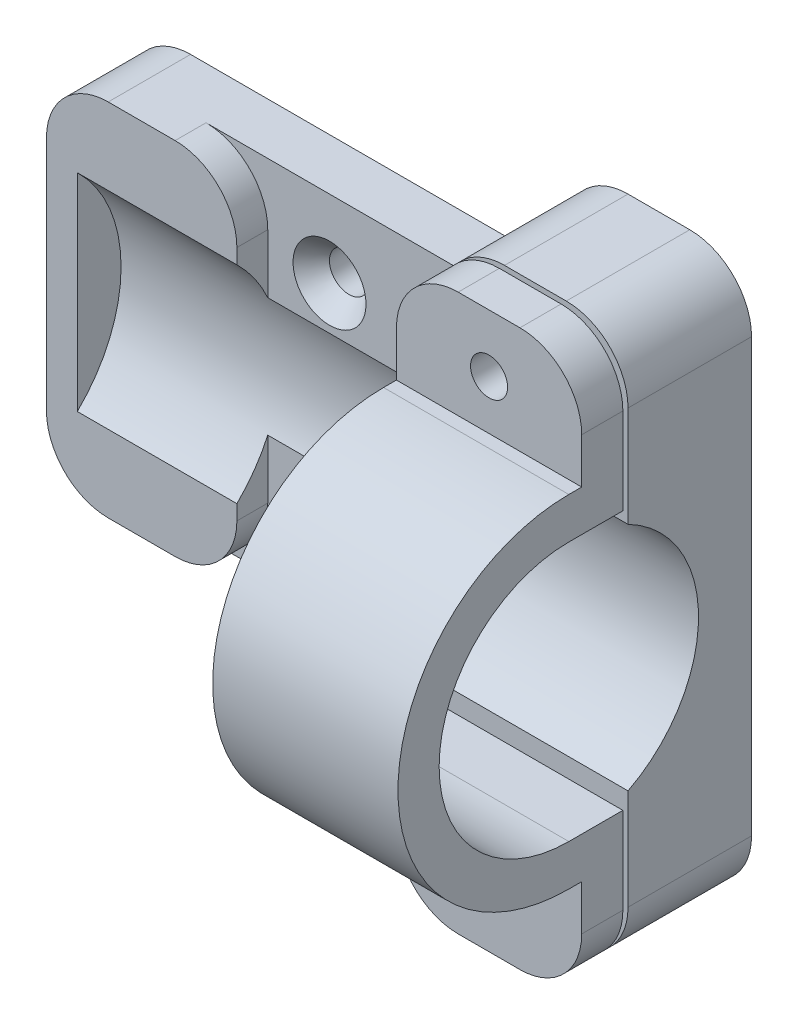
from build123d import *

# Parameters (mm, degrees)
BASE_SKETCH_W                        = 60.5
BASE_SKETCH_H                        = 35
BASE_EXTRUDE_DEPTH                   = 5
CRADLE_SKETCH_W                      = 18.5
CRADLE_SKETCH_H                      = 35
CRADLE_SKETCH_W_2                    = 18
CRADLE_SKETCH_H_2                    = 54
CRADLE_EXTRUDE_DEPTH                 = 12
NO_6_MOUNTING_HOLES_D                = 3.7973
NO_6_MOUNTING_HOLES_CSINK_D          = 7.0866
NO_6_MOUNTING_HOLES_CSINK_ANGLE      = 82
MOVE_START                           = 8
MOVE_FACE_OUTLINE_W                  = 18.5
MOVE_FACE_OUTLINE_H                  = 35
MOVE_FACE_DEPTH                      = 4
CLAMP_THREADED_HOLE_IN_BASE_D        = 2.5
CRADLE_FILLETS_R                     = 6
BASE_FILLETS_R                       = 6
MOTOR_START                          = 12
MOTOR_CLAMP_EXTRUDE_DEPTH            = 18
CLAMP_MOUNTING_HOLE_PROFILE_SKETCH_W = 1.8
CLAMP_MOUNTING_HOLE_PROFILE_SKETCH_H = 4
CLAMP_CORNER_FILLETS_R               = 6


# Read off the part's stored shape, not the designer's step: Move Face
with BuildPart() as part:
    # Base Sketch → Base Extrude (new body)
    with BuildSketch(Plane.XY):
        with Locations((-0.25, 0)):
            Rectangle(BASE_SKETCH_W, BASE_SKETCH_H)
    extrude(amount=BASE_EXTRUDE_DEPTH)

    # Cradle Sketch → Cradle Extrude (add)
    with BuildSketch(Plane.XY):
        with Locations((-21.25, 0)):
            Rectangle(CRADLE_SKETCH_W, CRADLE_SKETCH_H)
        with Locations((21, 0)):
            Rectangle(CRADLE_SKETCH_W_2, CRADLE_SKETCH_H_2)
    extrude(amount=CRADLE_EXTRUDE_DEPTH)

    # No. 6 Mounting Holes (through all)
    with Locations(Plane.XY.offset(5)):
        with Locations((-6, 10), (6, 10), (-6, -10), (6, -10)):
            CounterSinkHole(NO_6_MOUNTING_HOLES_D / 2, NO_6_MOUNTING_HOLES_CSINK_D / 2, counter_sink_angle=NO_6_MOUNTING_HOLES_CSINK_ANGLE)

    # Pump and Motor Revolve Cut Sketch → Pump and Motor Revolve Cut (revolve, cut)
    with BuildSketch(Plane(origin=(0, 0, 0), x_dir=(1, 0, 0), z_dir=(0, 1, 0))):
        Polygon((-27.5, -17.75), (-27.5, -3.75), (2, -3.75), (2, -5.15), (44.5, -5.15), (44.5, -17.75), align=None)
    revolve(axis=Axis((44.5, 0, 17.75), (-1, 0, 0)), mode=Mode.SUBTRACT)

    # Move Face outline → Move Face (cut)
    with BuildSketch(Plane.XY.offset(MOVE_START)):
        with Locations((-21.25, 0)):
            Rectangle(MOVE_FACE_OUTLINE_W, MOVE_FACE_OUTLINE_H)
    extrude(amount=MOVE_FACE_DEPTH, mode=Mode.SUBTRACT)

    # Clamp Threaded Hole in Base (through all)
    with Locations(Plane.XY.offset(12)):
        with Locations((21, -21.4)):
            clamp_threaded_hole_in_base = Hole(CLAMP_THREADED_HOLE_IN_BASE_D / 2)

    # Cradle Fillets
    cradle_fillets_edges = [part.edges().sort_by_distance(p)[0] for p in [
        (-12, -17.5, 6.5),
        (-12, 17.5, 6.5),
        (12, 27, 6),
        (30, -27, 6),
        (12, -27, 6),
        (30, 27, 6),
        (-30.5, -17.5, 4),
        (-30.5, 17.5, 4),
    ]]
    fillet(cradle_fillets_edges, radius=CRADLE_FILLETS_R)

    # Base Fillets
    # the kernel refuses this fillet: 6 mm, written as the material it adds along each edge
    with BuildSketch(Plane(origin=(12, 17.5, 5), x_dir=(0.027705718818601687, 0.9996161228915551, 0), z_dir=(0, 0, -1))) as base_fillets_piece_1:
        with BuildLine():
            CenterArc((5.83875749, -5.900726721), BASE_FILLETS_R, 100.437075268, 77.975300819)
            Line((-0.158939247, -5.734492409), (-0.758708921, -5.717868977))
            Line((-0.758708921, -5.717868977), (-0.599769674, 0.016623431))
            Line((-0.599769674, 0.016623431), (0.016623431, 0.599769674))
            ThreePointArc((0.016623431, 0.599769674), (3.515279861, 0.502799658), (4.643130779, 0.590072672))
            Line((4.643130779, 0.590072672), (4.751824117, 0))
        make_face()
    extrude(amount=5)
    with BuildSketch(Plane(origin=(12, -17.5, 0), x_dir=(-1, 0, 0), z_dir=(0, 0, 1))) as base_fillets_piece_2:
        with BuildLine():
            CenterArc((5.736694594, 6), BASE_FILLETS_R, 192.024699181, 77.975300819)
            Line((-0.131652703, 4.75), (-0.718487433, 4.625))
            ThreePointArc((-0.718487433, 4.625), (-0.6, 3.5), (-0.6, 0))
            Line((-0.6, 0), (0, -0.6))
            Line((0, -0.6), (5.736694594, -0.6))
            Line((5.736694594, -0.6), (5.736694594, 0))
        make_face()
    extrude(amount=5)


with BuildPart() as body_2:
    # Motor Clamp Sketch → Motor Clamp Extrude (new body)
    with BuildSketch(Plane(origin=(0, 0, 0), x_dir=(0, 0, -1), z_dir=(1, 0, 0)).offset(MOTOR_START)):
        with BuildLine():
            Line((-17.75, -16.6), (-16.5, -16.6))
            Line((-16.5, -16.6), (-16.5, -27))
            Line((-16.5, -27), (-12.5, -27))
            Line((-12.5, -27), (-12.5, -12.6))
            Line((-12.5, -12.6), (-17.75, -12.6))
            ThreePointArc((-17.75, -12.6), (-30.35, 0), (-17.75, 12.6))
            Line((-17.75, 12.6), (-12.5, 12.6))
            Line((-12.5, 12.6), (-12.5, 27))
            Line((-12.5, 27), (-16.5, 27))
            Line((-16.5, 27), (-16.5, 16.6))
            Line((-16.5, 16.6), (-17.75, 16.6))
            ThreePointArc((-17.75, 16.6), (-34.35, 0), (-17.75, -16.6))
        make_face()
    extrude(amount=MOTOR_CLAMP_EXTRUDE_DEPTH)

    # Clamp Mounting Hole Profile Sketch → Clamp Mounting Hole (revolve, cut)
    with BuildSketch(Plane(origin=(21, -21.4, 16.5), x_dir=(0, -1, 0), z_dir=(1, 0, 0))):
        with Locations((0.9, 2)):
            Rectangle(CLAMP_MOUNTING_HOLE_PROFILE_SKETCH_W, CLAMP_MOUNTING_HOLE_PROFILE_SKETCH_H)
    clamp_mounting_hole = revolve(axis=Axis((21, -21.4, 22.85), (0, 0, -1)), mode=Mode.SUBTRACT)


with BuildPart() as motor_clamp_screw_holes_mirror_tool:
    # Motor Clamp Screw Holes Mirror: Clamp Threaded Hole in Base, Clamp Mounting Hole across plane
    add(clamp_threaded_hole_in_base.mirror(Plane.ZX))
    add(clamp_mounting_hole.mirror(Plane.ZX))


with BuildPart() as part_1:
    add(part.part)

    # Motor Clamp Screw Holes Mirror: cut by motor_clamp_screw_holes_mirror_tool
    add(motor_clamp_screw_holes_mirror_tool.part, mode=Mode.SUBTRACT)


with BuildPart() as body_2_1:
    add(body_2.part)

    # Motor Clamp Screw Holes Mirror: cut by motor_clamp_screw_holes_mirror_tool
    add(motor_clamp_screw_holes_mirror_tool.part, mode=Mode.SUBTRACT)

    # Clamp Corner Fillets
    clamp_corner_fillets_edges = [body_2_1.edges().sort_by_distance(p)[0] for p in [
        (12, -27, 14.5),
        (12, 27, 14.5),
        (30, 27, 14.5),
        (30, -27, 14.5),
    ]]
    fillet(clamp_corner_fillets_edges, radius=CLAMP_CORNER_FILLETS_R)


solid = Compound([part_1.part, body_2_1.part])
